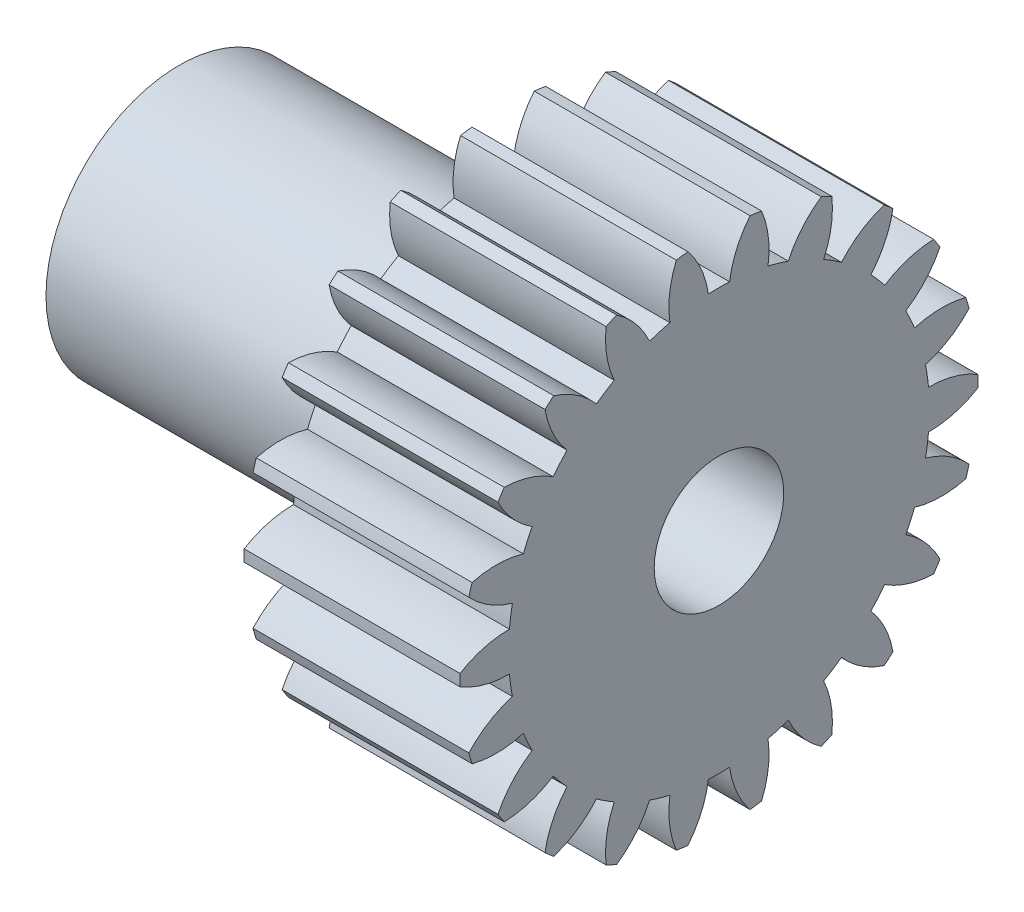
from build123d import *

# Parameters (mm, degrees)
BASPROSKE_W      = 10
BASPROSKE_H      = 12
TOOTHCUT_DEPTH   = 20.697715604
TEETHCUTS_COUNT  = 22
TEETHCUTS_ANGLE  = 343.636363636
HUBNEAONESKE_R   = 6.175
HUBNEARONE_DEPTH = 15.0000508
BORSKE_R         = 3
BORE_DEPTH       = 25.0000508


with BuildPart() as part:
    # BasProSke → Base-Revolve (revolve)
    with BuildSketch(Plane(origin=(0, 0, 0), x_dir=(1, 0, 0), z_dir=(0, 1, 0))):
        with Locations((5, 6)):
            Rectangle(BASPROSKE_W, BASPROSKE_H)
    revolve(axis=Axis((-10, 0, 0), (1, 0, 0)))

    # TooCutSke → ToothCut (cut, through all)
    with BuildSketch(Plane(origin=(0, 0, 0), x_dir=(0, 0, -1), z_dir=(1, 0, 0))):
        with BuildLine():
            ThreePointArc((0.491001901, 9.736627657), (0, 9.749), (-0.491001901, 9.736627657))
            ThreePointArc((-0.491001901, 9.736627657), (-0.822824844, 10.904005344), (-1.46093845, 11.936327074))
            ThreePointArc((-1.46093845, 11.936327074), (0, 12.0254), (1.46093845, 11.936327074))
            ThreePointArc((1.46093845, 11.936327074), (0.822824844, 10.904005344), (0.491001901, 9.736627657))
        make_face()
    toothcut = extrude(amount=TOOTHCUT_DEPTH, mode=Mode.SUBTRACT)

    # TeethCuts: ToothCut ×22 about axis
    teethcuts_axis = Axis((-10, 0, 0), (1, 0, 0))
    for i in range(1, TEETHCUTS_COUNT):
        add(toothcut.rotate(teethcuts_axis, i * TEETHCUTS_ANGLE / (TEETHCUTS_COUNT - 1)), mode=Mode.SUBTRACT)

    # HubNeaOneSke → HubNearOne (add)
    with BuildSketch(Plane.ZY):
        Circle(HUBNEAONESKE_R)
    extrude(amount=HUBNEARONE_DEPTH)

    # BorSke → Bore (cut, symmetric)
    with BuildSketch(Plane(origin=(0, 0, 0), x_dir=(0, 0, -1), z_dir=(1, 0, 0))):
        Circle(BORSKE_R)
    extrude(amount=BORE_DEPTH, both=True, mode=Mode.SUBTRACT)


solid = part.part
